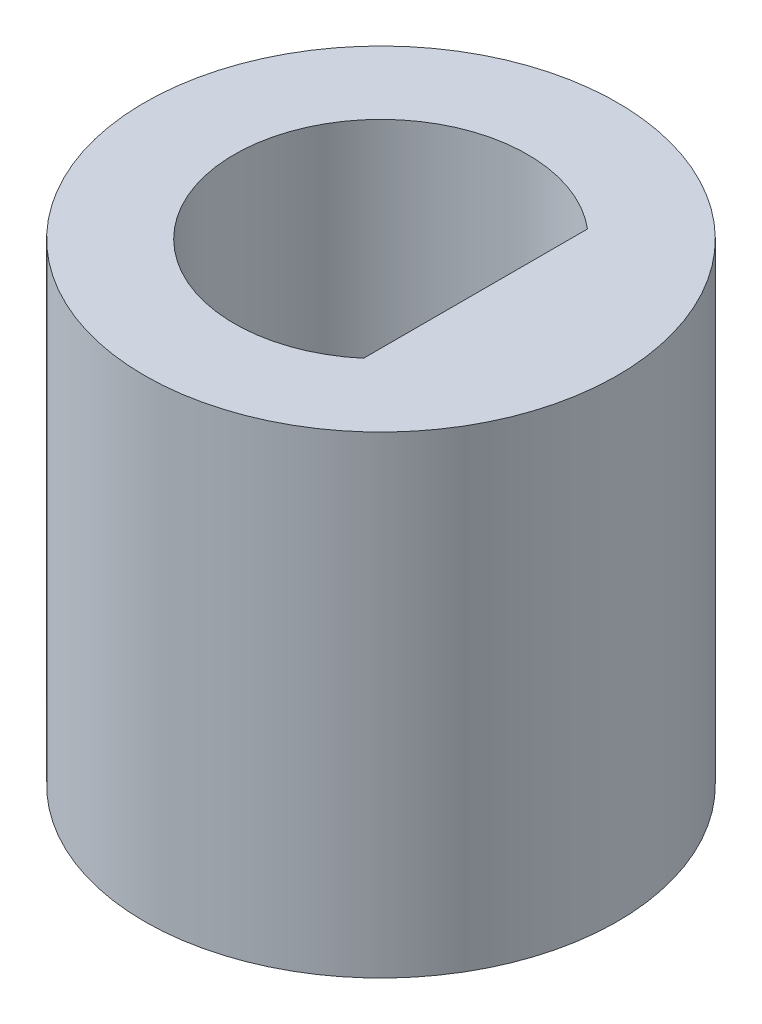
from build123d import *

# Parameters (mm, degrees)
EXTRUDE_1_DEPTH      = 0.25
EXTRUDE_1_DEPTH_BACK = 0.25
SKETCH_1_R           = 2.5
SKETCH_1_R_2         = 1.4
EXTRUDE_2_DEPTH      = 2.5
EXTRUDE_2_DEPTH_BACK = 2.5
SKETCH_1_3_R         = 2.5


with BuildPart() as part:
    # 草图1 → 凸台-拉伸1 (new, two sides: drawn at the far end of the back side and taken through both)
    with BuildSketch(Plane(origin=(0, 0, 0), x_dir=(1, 0, 0), z_dir=(0, 1, 0)).offset(-EXTRUDE_1_DEPTH_BACK)):
        Circle(SKETCH_1_R)
        Circle(SKETCH_1_R_2, mode=Mode.SUBTRACT)
    extrude(amount=EXTRUDE_1_DEPTH + EXTRUDE_1_DEPTH_BACK)

    # 草图1<3> → 凸台-拉伸2 (add, two sides: drawn at the far end of the back side and taken through both)
    with BuildSketch(Plane(origin=(0, 0, 0), x_dir=(1, 0, 0), z_dir=(0, 1, 0)).offset(-EXTRUDE_2_DEPTH_BACK)):
        Circle(SKETCH_1_3_R)
        with BuildLine():
            ThreePointArc((1, -1.184271928), (-1.55, 0), (1, 1.184271928))
            Line((1, 1.184271928), (1, -1.184271928))
        make_face(mode=Mode.SUBTRACT)
    extrude(amount=EXTRUDE_2_DEPTH + EXTRUDE_2_DEPTH_BACK)


solid = part.part
